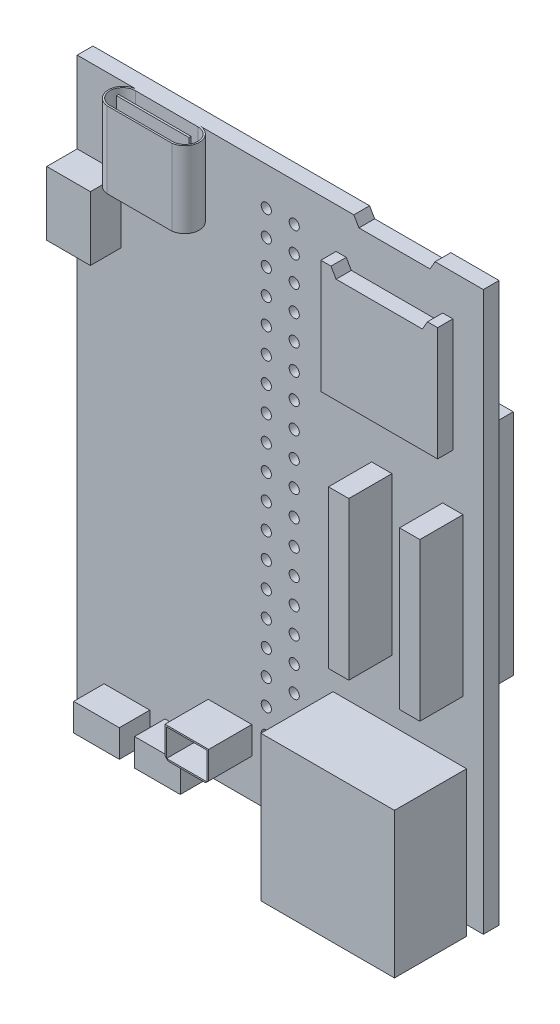
from build123d import *

# Parameters (mm, degrees)
SKETCH1_W            = 55
SKETCH1_H            = 40
BOSS_EXTRUDE1_DEPTH  = 1.55
SKETCH2_W            = 13.15
SKETCH2_H            = 14.3
BOSS_EXTRUDE2_DEPTH  = 7.1
CUT_EXTRUDE1_DEPTH   = 13.3
SKETCH4_W            = 8.95
SKETCH4_H            = 7.5
BOSS_EXTRUDE3_DEPTH  = 2.85
CUT_EXTRUDE2_DEPTH   = 7.5
SKETCH5_3_W          = 7.15
SKETCH5_3_H          = 0.2
CUT_EXTRUDE3_DEPTH   = 7
BOSS_EXTRUDE4_DEPTH  = 1.5
CUT_EXTRUDE4_DEPTH   = 10
SKETCH8_W            = 4.5
SKETCH8_H            = 2.7
BOSS_EXTRUDE5_DEPTH  = 3
SKETCH9_R            = 1
BOSS_EXTRUDE6_DEPTH  = 0.5
SKETCH10_W           = 2
SKETCH10_H           = 15.5
BOSS_EXTRUDE7_DEPTH  = 4.25
SKETCH8_4_W          = 4.3
SKETCH8_4_H          = 3
BOSS_EXTRUDE9_DEPTH  = 4.25
SHELL2_T             = -0.15
CHAMFER1_SIZE        = 0.3
SKETCH11_R           = 0.5
CUT_EXTRUDE5_DEPTH   = 1.55
SKETCH12_W           = 4.3
SKETCH12_H           = 6.3
BOSS_EXTRUDE10_DEPTH = 3
SHELL3_T             = -0.2
SKETCH13_W           = 2.9
SKETCH13_H           = 22.5
BOSS_EXTRUDE11_DEPTH = 3


with BuildPart() as part:
    # Sketch1 → Boss-Extrude1 (new body)
    with BuildSketch(Plane(origin=(0, 0, 0), x_dir=(0, 1, 0), z_dir=(0, 0, 1))):
        Rectangle(SKETCH1_W, SKETCH1_H)
    extrude(amount=BOSS_EXTRUDE1_DEPTH)

    # Sketch2 → Boss-Extrude2 (add)
    with BuildSketch(Plane.XY.offset(1.55)):
        with Locations((11.775, -21.35)):
            Rectangle(SKETCH2_W, SKETCH2_H)
    extrude(amount=BOSS_EXTRUDE2_DEPTH)

    # Sketch3 → Cut-Extrude1 (cut)
    with BuildSketch(Plane.XZ.offset(28.5)):
        Polygon((5.525, 8.35), (5.525, 1.85), (18.025, 1.85), (18.025, 5.352318912), (6.225, 5.352318912), (6.225, 6.85), (18.025, 6.85), (18.025, 8.35), align=None)
    extrude(amount=-CUT_EXTRUDE1_DEPTH, mode=Mode.SUBTRACT)

    # Sketch4 → Boss-Extrude3 (add)
    with BuildSketch(Plane.XY.offset(1.55)):
        with Locations((-11.025, 23.75)):
            Rectangle(SKETCH4_W, SKETCH4_H)
    extrude(amount=BOSS_EXTRUDE3_DEPTH)

    # Sketch5 → Cut-Extrude2 (cut)
    with BuildSketch(Plane(origin=(0, 27.5, 0), x_dir=(-1, 0, 0), z_dir=(0, 1, 0))):
        with BuildLine():
            Line((6.55, 4.4), (6.55, 2.975))
            ThreePointArc((6.55, 2.975), (6.910359128, 3.926260685), (7.810540583, 4.4))
            Line((7.810540583, 4.4), (6.55, 4.4))
        make_face()
        with BuildLine():
            Line((6.55, 1.55), (7.810540583, 1.55))
            ThreePointArc((7.810540583, 1.55), (6.910359128, 2.023739315), (6.55, 2.975))
            Line((6.55, 2.975), (6.55, 1.55))
        make_face()
        with BuildLine():
            Line((15.5, 1.55), (15.5, 2.975))
            ThreePointArc((15.5, 2.975), (15.139640872, 2.023739315), (14.239459417, 1.55))
            Line((14.239459417, 1.55), (15.5, 1.55))
        make_face()
        with BuildLine():
            Line((15.5, 4.4), (14.239459417, 4.4))
            ThreePointArc((14.239459417, 4.4), (15.139640872, 3.926260685), (15.5, 2.975))
            Line((15.5, 2.975), (15.5, 4.4))
        make_face()
    extrude(amount=-CUT_EXTRUDE2_DEPTH, mode=Mode.SUBTRACT)

    # Sketch5<3> → Cut-Extrude3 (cut)
    with BuildSketch(Plane(origin=(0, 27.5, 0), x_dir=(-1, 0, 0), z_dir=(0, 1, 0))):
        with BuildLine():
            Line((7.95, 1.719461162), (14.1, 1.719461162))
            ThreePointArc((14.1, 1.719461162), (15.355538838, 2.975), (14.1, 4.230538838))
            Line((14.1, 4.230538838), (7.95, 4.230538838))
            ThreePointArc((7.95, 4.230538838), (6.694461162, 2.975), (7.95, 1.719461162))
        make_face()
        with Locations((11.025, 2.975)):
            Rectangle(SKETCH5_3_W, SKETCH5_3_H, mode=Mode.SUBTRACT)
    extrude(amount=-CUT_EXTRUDE3_DEPTH, mode=Mode.SUBTRACT)

    # Sketch6 → Boss-Extrude4 (add)
    with BuildSketch(Plane.XY.offset(1.55)):
        Polygon((16, 23.5), (15.5, 22.633974596), (7, 22.633974596), (6.5, 23.5), (5.5, 23.5), (5.5, 12.3), (17, 12.3), (17, 23.5), align=None)
    extrude(amount=BOSS_EXTRUDE4_DEPTH)

    # Sketch7 → Cut-Extrude4 (cut)
    with BuildSketch(Plane.XY.offset(1.55)):
        Polygon((7.25, 27.5), (7.75, 26.633974596), (14.75, 26.633974596), (15.25, 27.5), align=None)
    extrude(amount=-CUT_EXTRUDE4_DEPTH, mode=Mode.SUBTRACT)

    # Sketch8 → Boss-Extrude5 (add)
    with BuildSketch(Plane.XY.offset(1.55)):
        with Locations((-9.1, -26.15)):
            Rectangle(SKETCH8_W, SKETCH8_H)
        with Locations((-15.1, -26.15)):
            Rectangle(SKETCH8_W, SKETCH8_H)
    extrude(amount=BOSS_EXTRUDE5_DEPTH)

    # Sketch9 → Boss-Extrude6 (add)
    with BuildSketch(Plane.XZ.offset(27.5)):
        with Locations(Location((-9.1, 3.05, 0), (0, 0, 270))):
            Circle(SKETCH9_R)
        with Locations(Location((-15.1, 3.05, 0), (0, 0, 90))):
            Circle(SKETCH9_R)
    extrude(amount=BOSS_EXTRUDE6_DEPTH)

    # Sketch10 → Boss-Extrude7 (add)
    with BuildSketch(Plane.XY.offset(1.55)):
        with Locations((17, -0.45)):
            Rectangle(SKETCH10_W, SKETCH10_H)
        with Locations((10, -0.45)):
            Rectangle(SKETCH10_W, SKETCH10_H)
    extrude(amount=BOSS_EXTRUDE7_DEPTH)


with BuildPart() as body_2:
    # Sketch8<4> → Boss-Extrude9 (new body)
    with BuildSketch(Plane.XY.offset(1.55)):
        with Locations((-4.95, -22.5)):
            Rectangle(SKETCH8_4_W, SKETCH8_4_H)
    extrude(amount=BOSS_EXTRUDE9_DEPTH)

    # Shell2
    shell2_openings = [body_2.faces().sort_by_distance(p)[0] for p in [
        (-4.95, -22.5, 5.8),
    ]]
    offset(amount=SHELL2_T, openings=shell2_openings, kind=Kind.INTERSECTION)


with BuildPart() as part_1:
    add(part.part)

    # Combine1: union body 2
    add(body_2.part)

    # Chamfer1
    chamfer1_edges = [part_1.edges().sort_by_distance(p)[0] for p in [
        (-2.8, -24, 3.675),
        (-7.1, -24, 3.675),
    ]]
    chamfer(chamfer1_edges, length=CHAMFER1_SIZE - 0.0001)  # a hair under: the kernel refuses the full size

    # Sketch11 → Cut-Extrude5 (cut)
    with BuildSketch(Plane.XY.offset(1.55)):
        with Locations((1.375, 23.75)):
            Circle(SKETCH11_R)
        with Locations((1.375, 21.25)):
            Circle(SKETCH11_R)
        with Locations((1.375, 18.75)):
            Circle(SKETCH11_R)
        with Locations((1.375, 16.25)):
            Circle(SKETCH11_R)
        with Locations((1.375, 13.75)):
            Circle(SKETCH11_R)
        with Locations((1.375, 11.25)):
            Circle(SKETCH11_R)
        with Locations((1.375, 8.75)):
            Circle(SKETCH11_R)
        with Locations((1.375, 6.25)):
            Circle(SKETCH11_R)
        with Locations((1.375, 3.75)):
            Circle(SKETCH11_R)
        with Locations((1.375, 1.25)):
            Circle(SKETCH11_R)
        with Locations((1.375, -1.25)):
            Circle(SKETCH11_R)
        with Locations((1.375, -3.75)):
            Circle(SKETCH11_R)
        with Locations((1.375, -6.25)):
            Circle(SKETCH11_R)
        with Locations((1.375, -8.75)):
            Circle(SKETCH11_R)
        with Locations((1.375, -11.25)):
            Circle(SKETCH11_R)
        with Locations((1.375, -13.75)):
            Circle(SKETCH11_R)
        with Locations((1.375, -16.25)):
            Circle(SKETCH11_R)
        with Locations((1.375, -18.75)):
            Circle(SKETCH11_R)
        with Locations((1.375, -21.25)):
            Circle(SKETCH11_R)
        with Locations((1.375, -23.75)):
            Circle(SKETCH11_R)
        with Locations(Location((-1.375, -23.75, 0), (0, 0, 180))):
            Circle(SKETCH11_R)
        with Locations(Location((-1.375, -21.25, 0), (0, 0, 180))):
            Circle(SKETCH11_R)
        with Locations(Location((-1.375, -18.75, 0), (0, 0, 180))):
            Circle(SKETCH11_R)
        with Locations(Location((-1.375, -16.25, 0), (0, 0, 180))):
            Circle(SKETCH11_R)
        with Locations(Location((-1.375, -13.75, 0), (0, 0, 180))):
            Circle(SKETCH11_R)
        with Locations(Location((-1.375, -11.25, 0), (0, 0, 180))):
            Circle(SKETCH11_R)
        with Locations(Location((-1.375, -8.75, 0), (0, 0, 180))):
            Circle(SKETCH11_R)
        with Locations(Location((-1.375, -6.25, 0), (0, 0, 180))):
            Circle(SKETCH11_R)
        with Locations(Location((-1.375, -3.75, 0), (0, 0, 180))):
            Circle(SKETCH11_R)
        with Locations(Location((-1.375, -1.25, 0), (0, 0, 180))):
            Circle(SKETCH11_R)
        with Locations(Location((-1.375, 1.25, 0), (0, 0, 180))):
            Circle(SKETCH11_R)
        with Locations(Location((-1.375, 3.75, 0), (0, 0, 180))):
            Circle(SKETCH11_R)
        with Locations(Location((-1.375, 6.25, 0), (0, 0, 180))):
            Circle(SKETCH11_R)
        with Locations(Location((-1.375, 8.75, 0), (0, 0, 180))):
            Circle(SKETCH11_R)
        with Locations(Location((-1.375, 11.25, 0), (0, 0, 180))):
            Circle(SKETCH11_R)
        with Locations(Location((-1.375, 13.75, 0), (0, 0, 180))):
            Circle(SKETCH11_R)
        with Locations(Location((-1.375, 16.25, 0), (0, 0, 180))):
            Circle(SKETCH11_R)
        with Locations(Location((-1.375, 18.75, 0), (0, 0, 180))):
            Circle(SKETCH11_R)
        with Locations(Location((-1.375, 23.75, 0), (0, 0, 180))):
            Circle(SKETCH11_R)
        with Locations(Location((-1.375, 21.25, 0), (0, 0, 180))):
            Circle(SKETCH11_R)
    extrude(amount=-CUT_EXTRUDE5_DEPTH, mode=Mode.SUBTRACT)

    # Sketch13 → Boss-Extrude11 (add)
    with BuildSketch(Plane(origin=(0, 0, 0), x_dir=(1, 0, 0), z_dir=(0, 0, -1))):
        with Locations((16.95, -2.75)):
            Rectangle(SKETCH13_W, SKETCH13_H)
        with Locations((-16.95, -2.75)):
            Rectangle(SKETCH13_W, SKETCH13_H)
    extrude(amount=BOSS_EXTRUDE11_DEPTH)


with BuildPart() as body_2_2:
    # Sketch12 → Boss-Extrude10 (new body)
    with BuildSketch(Plane.XY.offset(1.55)):
        with Locations((-17.85, 16.35)):
            Rectangle(SKETCH12_W, SKETCH12_H)
    extrude(amount=BOSS_EXTRUDE10_DEPTH)

    # Shell3
    shell3_openings = [body_2_2.faces().sort_by_distance(p)[0] for p in [
        (-20, 16.35, 3.05),
    ]]
    offset(amount=SHELL3_T, openings=shell3_openings, kind=Kind.INTERSECTION)


solid = Compound([part_1.part, body_2_2.part])
